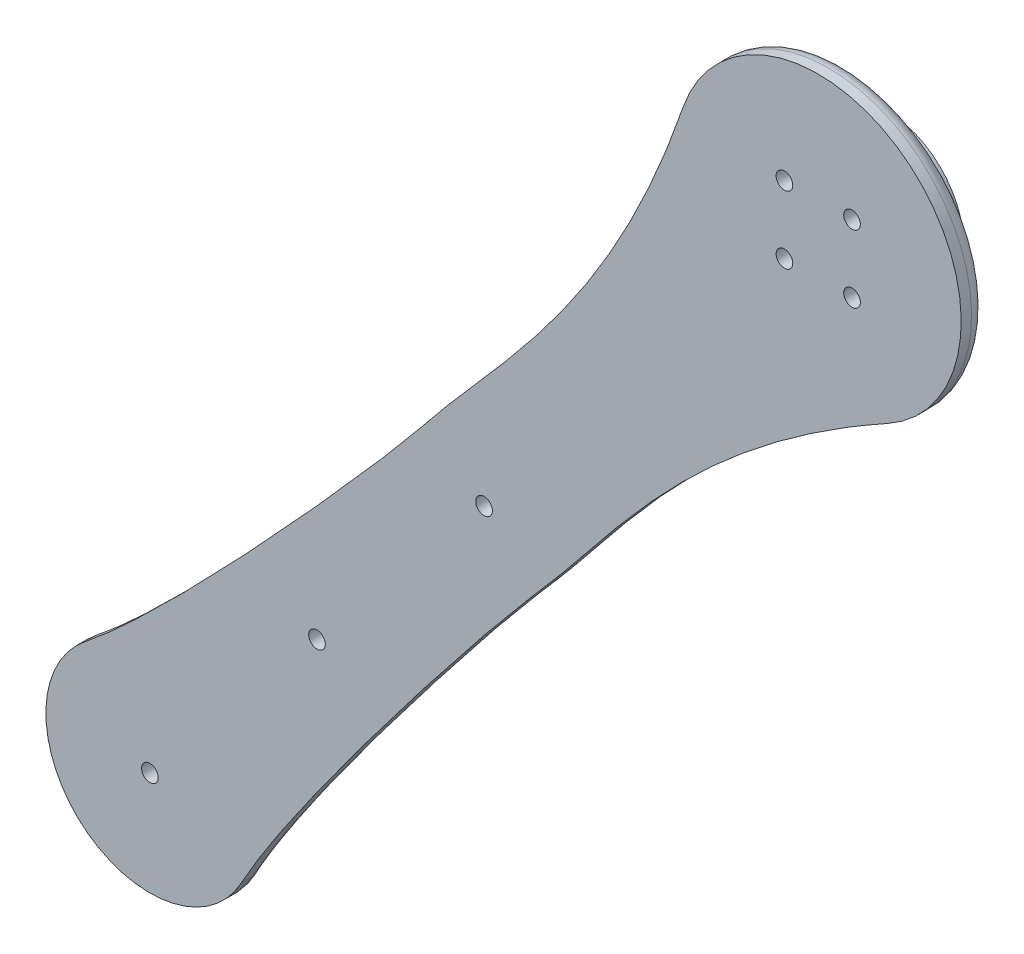
from build123d import *

# Parameters (mm, degrees)
SKETCH1_R           = 1.6
BOSS_EXTRUDE1_DEPTH = 5
SKETCH2_R           = 16
SKETCH2_R_2         = 1.6
BOSS_EXTRUDE2_DEPTH = 1
BOSS_EXTRUDE3_START = 7
SKETCH3_R           = 15
SKETCH3_R_2         = 1.6
BOSS_EXTRUDE3_DEPTH = 7
SKETCH4_R           = 3
CUT_EXTRUDE1_DEPTH  = 3
VARFILLET2_R        = 3


with BuildPart() as part:
    # Sketch1 → Boss-Extrude1 (new body)
    with BuildSketch(Plane.XY.offset(11)):
        with BuildLine():
            ThreePointArc((155.019115612, -142.985112199), (159.394881243, -97.849485606), (115.704809966, -109.996492831))
            add(Edge.make_bspline(
                [(115.704809966, -109.996492831), (101.94879758, -150.116707379), (78.178790791, -171.772825461), (58.717079478, -197.082387325), (16.356999542, -244.049515564), (0.72448619, -256.46124476)],
                knots=[0, 0, 0, 0, 0.619090324, 0.719090324, 1, 1, 1, 1], degree=3))
            ThreePointArc((0.72448619, -256.46124476), (0.304947846, -287.445485278), (30.74561606, -281.651963762))
            add(Edge.make_bspline(
                [(155.019115612, -142.985112199), (117.897123756, -163.498941991), (100.69762913, -190.668374405), (79.152067085, -214.229377889), (40.254225745, -264.101669257), (30.74561606, -281.651963762)],
                knots=[0, 0, 0, 0, 0.619090324, 0.719090324, 1, 1, 1, 1], degree=3))
        make_face()
        with Locations((135.218221977, -112.415707792)):
            Circle(SKETCH1_R, mode=Mode.SUBTRACT)
        with Locations((148.218221977, -112.415707792)):
            Circle(SKETCH1_R, mode=Mode.SUBTRACT)
        with Locations((148.218221977, -125.415707792)):
            Circle(SKETCH1_R, mode=Mode.SUBTRACT)
        with Locations((135.218221977, -125.415707792)):
            Circle(SKETCH1_R, mode=Mode.SUBTRACT)
        with Locations((77.439461008, -195.520152104)):
            Circle(SKETCH1_R, mode=Mode.SUBTRACT)
        with Locations((45.300080524, -233.82237426)):
            Circle(SKETCH1_R, mode=Mode.SUBTRACT)
        with Locations((13.16070004, -272.124596416)):
            Circle(SKETCH1_R, mode=Mode.SUBTRACT)
    extrude(amount=BOSS_EXTRUDE1_DEPTH)

    # VarFillet2
    varfillet2_edges = [part.edges().sort_by_distance(p)[0] for p in [
        (65.360846316, -188.427744165, 11),
        (86.521548764, -206.183681785, 11),
    ]]
    fillet(varfillet2_edges, radius=VARFILLET2_R)


with BuildPart() as body_2:
    # Sketch2 → Boss-Extrude2 (new body)
    with BuildSketch(Plane(origin=(0, 0, 11), x_dir=(-1, 0, 0), z_dir=(0, 0, -1))):
        with Locations((-141.718221977, -118.915707792)):
            Circle(SKETCH2_R)
        with Locations((-148.218221977, -125.415707792)):
            Circle(SKETCH2_R_2, mode=Mode.SUBTRACT)
        with Locations((-135.218221977, -125.415707792)):
            Circle(SKETCH2_R_2, mode=Mode.SUBTRACT)
        with Locations((-148.218221977, -112.415707792)):
            Circle(SKETCH2_R_2, mode=Mode.SUBTRACT)
        with Locations((-135.218221977, -112.415707792)):
            Circle(SKETCH2_R_2, mode=Mode.SUBTRACT)
    extrude(amount=BOSS_EXTRUDE2_DEPTH)

    # Sketch3 → Boss-Extrude3 (add)
    with BuildSketch(Plane(origin=(0, 0, 10), x_dir=(-1, 0, 0), z_dir=(0, 0, -1)).offset(BOSS_EXTRUDE3_START)):
        with Locations((-141.718221977, -118.915707792)):
            Circle(SKETCH3_R)
        with Locations((-148.218221977, -125.415707792)):
            Circle(SKETCH3_R_2, mode=Mode.SUBTRACT)
        with Locations((-135.218221977, -125.415707792)):
            Circle(SKETCH3_R_2, mode=Mode.SUBTRACT)
        with Locations((-148.218221977, -112.415707792)):
            Circle(SKETCH3_R_2, mode=Mode.SUBTRACT)
        with Locations((-135.218221977, -112.415707792)):
            Circle(SKETCH3_R_2, mode=Mode.SUBTRACT)
    extrude(amount=-BOSS_EXTRUDE3_DEPTH)

    # Sketch4 → Cut-Extrude1 (cut)
    with BuildSketch(Plane(origin=(0, 0, 3), x_dir=(-1, 0, 0), z_dir=(0, 0, -1))):
        with Locations((-148.218221977, -112.415707792)):
            Circle(SKETCH4_R)
        with Locations((-135.218221977, -112.415707792)):
            Circle(SKETCH4_R)
        with Locations((-135.218221977, -125.415707792)):
            Circle(SKETCH4_R)
        with Locations((-148.218221977, -125.415707792)):
            Circle(SKETCH4_R)
    extrude(amount=-CUT_EXTRUDE1_DEPTH, mode=Mode.SUBTRACT)


solid = Compound([part.part, body_2.part])
